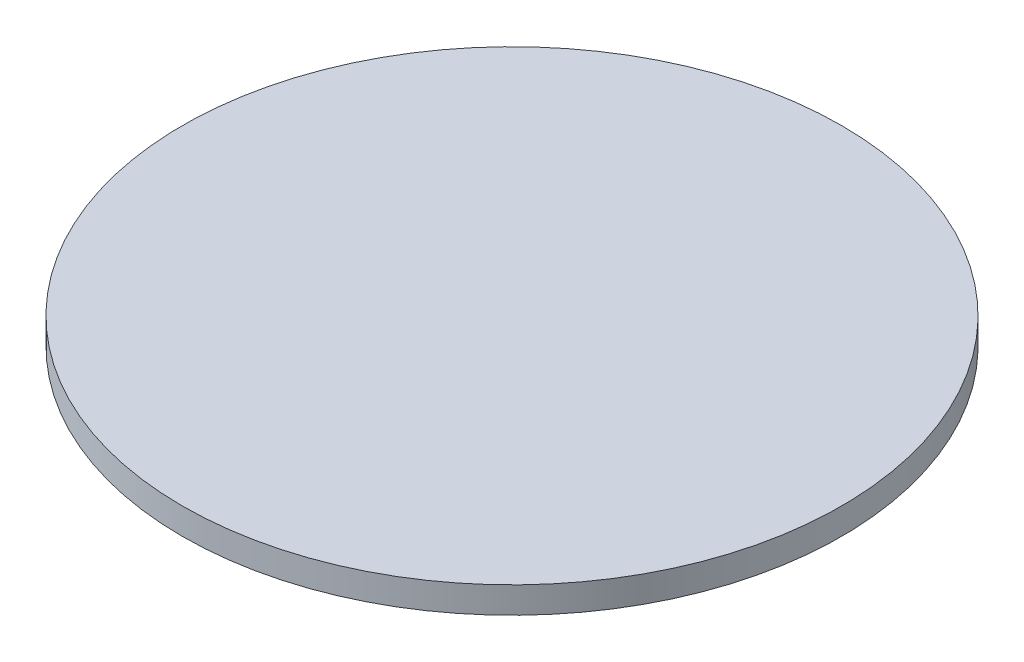
from build123d import *

# Parameters (mm, degrees)
SKETCH1_R           = 150
BOSS_EXTRUDE1_DEPTH = 12


with BuildPart() as part:
    # Sketch1 → Boss-Extrude1 (new body)
    with BuildSketch(Plane(origin=(0, 0, 0), x_dir=(1, 0, 0), z_dir=(0, 1, 0))):
        Circle(SKETCH1_R)
    extrude(amount=BOSS_EXTRUDE1_DEPTH)


solid = part.part
